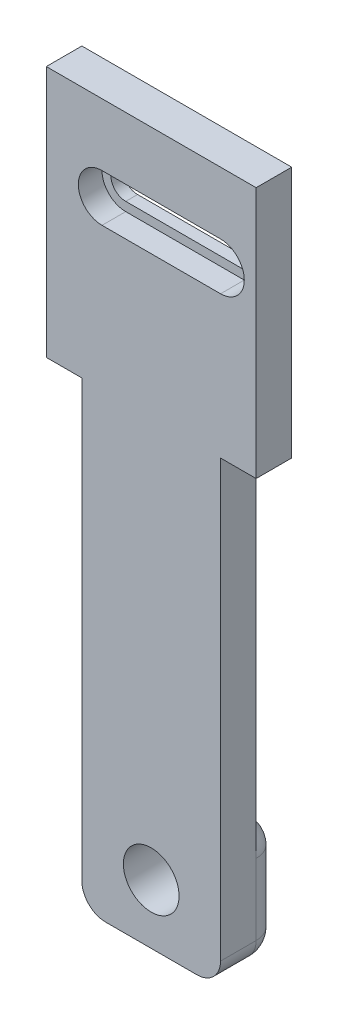
from build123d import *

# Parameters (mm, degrees)
SKETCH1_W               = 17.7
SKETCH1_H               = 60
BOSS_EXTRUDE1_DEPTH     = 3
SKETCH2_W               = 3
SKETCH2_H               = 38.75
CUT_EXTRUDE1_DEPTH      = 56.240991234
CUT_EXTRUDE2_DEPTH      = 56.240991234
CUT_EXTRUDE3_DEPTH      = 2
SKETCH5_W               = 11.7
SKETCH5_H               = 10
BOSS_EXTRUDE2_DEPTH     = 2
CUT_EXTRUDE4_DEPTH      = 56.385621893
CUT_EXTRUDE4_DEPTH_BACK = 56.385621893
SKETCH6_R               = 2.35
FILLET1_R               = 2
FILLET2_R               = 2
FILLET3_R               = 2
FILLET4_R               = 2


with BuildPart() as part:
    # Sketch1 → Boss-Extrude1 (new body)
    with BuildSketch(Plane.XY):
        with Locations((-34.564285714, 4.025974026)):
            Rectangle(SKETCH1_W, SKETCH1_H)
    extrude(amount=BOSS_EXTRUDE1_DEPTH)

    # Sketch2 → Cut-Extrude1 (cut, through all)
    with BuildSketch(Plane.XY.offset(3)):
        with Locations((-41.914285714, -6.599025974)):
            Rectangle(SKETCH2_W, SKETCH2_H)
        with Locations((-27.214285714, -6.599025974)):
            Rectangle(SKETCH2_W, SKETCH2_H)
    extrude(amount=-CUT_EXTRUDE1_DEPTH, mode=Mode.SUBTRACT)

    # Sketch3 → Cut-Extrude2 (cut, through all)
    with BuildSketch(Plane.XY.offset(3)):
        with BuildLine():
            Line((-28.714285714, 25.525974026), (-38.714285714, 25.525974026))
            ThreePointArc((-38.714285714, 25.525974026), (-39.964285714, 26.775974026), (-38.714285714, 28.025974026))
            Line((-38.714285714, 28.025974026), (-28.714285714, 28.025974026))
            ThreePointArc((-28.714285714, 28.025974026), (-27.464285714, 26.775974026), (-28.714285714, 25.525974026))
        make_face()
    extrude(amount=-CUT_EXTRUDE2_DEPTH, mode=Mode.SUBTRACT)

    # Sketch4 → Cut-Extrude3 (cut)
    with BuildSketch(Plane.XY.offset(3)):
        with BuildLine():
            Line((-38.714285714, 28.775974026), (-28.714285714, 28.775974026))
            ThreePointArc((-28.714285714, 28.775974026), (-26.714285714, 26.775974026), (-28.714285714, 24.775974026))
            Line((-28.714285714, 24.775974026), (-38.714285714, 24.775974026))
            ThreePointArc((-38.714285714, 24.775974026), (-40.714285714, 26.775974026), (-38.714285714, 28.775974026))
        make_face()
    extrude(amount=-CUT_EXTRUDE3_DEPTH, mode=Mode.SUBTRACT)

    # Sketch5 → Boss-Extrude2 (add)
    with BuildSketch(Plane(origin=(0, 0, 0), x_dir=(-1, 0, 0), z_dir=(0, 0, -1))):
        with Locations((34.564285714, -20.974025974)):
            Rectangle(SKETCH5_W, SKETCH5_H)
    extrude(amount=BOSS_EXTRUDE2_DEPTH)

    # Sketch6 → Cut-Extrude4 (cut, two sides: drawn at the far end of the back side and taken through both)
    with BuildSketch(Plane(origin=(0, 0, -2), x_dir=(-1, 0, 0), z_dir=(0, 0, -1)).offset(-CUT_EXTRUDE4_DEPTH_BACK)):
        with Locations((34.564285714, -20.974025974)):
            Circle(SKETCH6_R)
    extrude(amount=CUT_EXTRUDE4_DEPTH + CUT_EXTRUDE4_DEPTH_BACK, mode=Mode.SUBTRACT)

    # Fillet1
    fillet1_edges = [part.edges().sort_by_distance(p)[0] for p in [
        (-34.564285714, -25.974025974, -2),
    ]]
    fillet(fillet1_edges, radius=FILLET1_R)

    # Fillet2
    fillet2_edges = [part.edges().sort_by_distance(p)[0] for p in [
        (-34.564285714, -15.974025974, -2),
    ]]
    fillet(fillet2_edges, radius=FILLET2_R - 0.0001)  # a hair under: the kernel refuses the full size

    # Fillet3
    fillet3_edges = [part.edges().sort_by_distance(p)[0] for p in [
        (-28.714285714, -25.974025974, 1.5),
        (-28.714285714, -25.388239536, -1.414213562),
        (-28.714285714, -20.973975974, -2),
        (-28.714285714, -16.559783122, -1.414242852),
    ]]
    fillet(fillet3_edges, radius=FILLET3_R - 0.0001)  # a hair under: the kernel refuses the full size

    # Fillet4
    fillet4_edges = [part.edges().sort_by_distance(p)[0] for p in [
        (-40.414285714, -20.973975974, -2),
        (-40.414285714, -25.974025974, 1.5),
        (-40.414285714, -25.388239536, -1.414213562),
        (-40.414285714, -16.559783122, -1.414242852),
    ]]
    fillet(fillet4_edges, radius=FILLET4_R - 0.0001)  # a hair under: the kernel refuses the full size


solid = part.part
